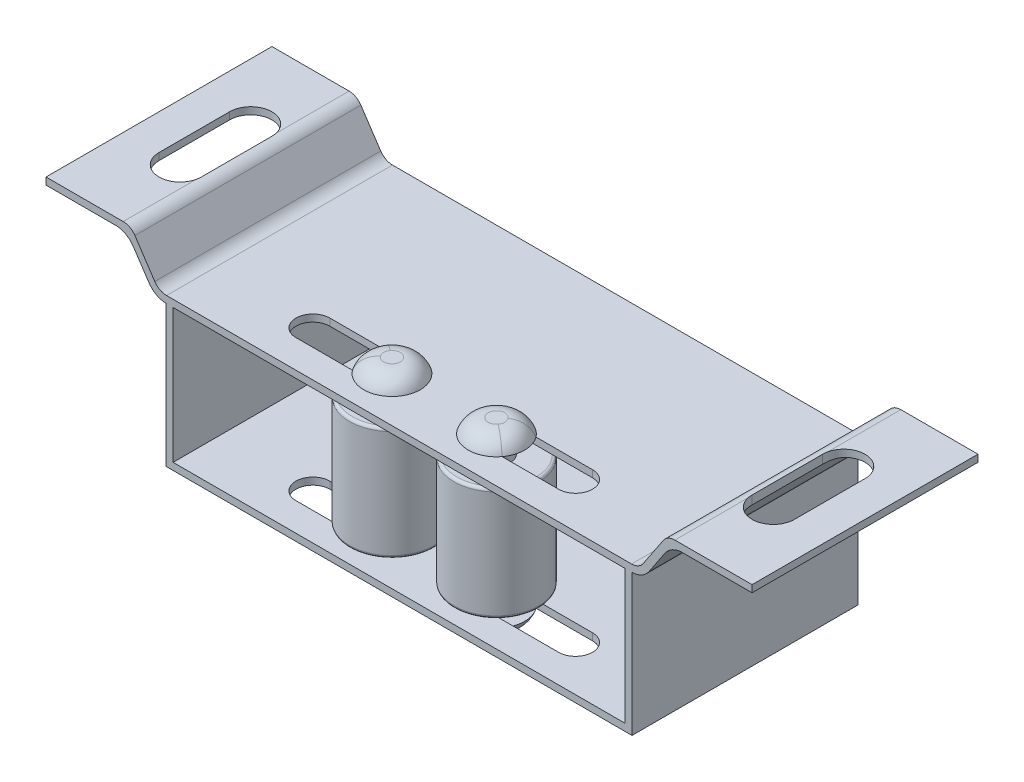
from build123d import *

# Parameters (mm, degrees)
EXTRUDE_1_DEPTH     = 8
SKETCH_2_W          = 33
SKETCH_2_H          = 16
EXTRUDE_1_2_DEPTH   = 10
SHELL_START         = -10
SHELL_1_OUTLINE_W   = 32
SHELL_1_OUTLINE_H   = 15.5
SHELL_1_DEPTH       = 9.5
FILLET_1_R          = 1.5
FILLET_2_R          = 1
CUT_EXTRUDE_1_DEPTH = 30.516944286
SKETCH_4_R          = 1
EXTRUDE_2_DEPTH     = 5.25
EXTRUDE_2_2_DEPTH   = 5.25
SKETCH_5_R          = 2
EXTRUDE_3_DEPTH     = 1
FILLET_3_R          = 1.5
SKETCH_6_R          = 2
EXTRUDE_4_DEPTH     = 1
FILLET_4_R          = 1.5
SKETCH_7_R          = 3
EXTRUDE_5_DEPTH     = 4
CUT_EXTRUDE_2_DEPTH = 4
FILLET_5_R          = 0.2


# Read off the part's stored shape, not the designer's step: 抽壳1
with BuildPart() as part:
    # 草图1 → Extrude 1 (new, symmetric)
    with BuildSketch(Plane.XY):
        Polygon((-25, 3), (-19, 3), (-17, 0), (17, 0), (19, 3), (25, 3), (25, 2.5), (19.267591879, 2.5), (17.267591879, -0.5), (-17.267591879, -0.5), (-19.267591879, 2.5), (-25, 2.5), align=None)
    extrude(amount=EXTRUDE_1_DEPTH, both=True)

    # 草图2 → Extrude 1 2 (add)
    with BuildSketch(Plane.XZ.offset(0.5)):
        Rectangle(SKETCH_2_W, SKETCH_2_H)
    extrude(amount=EXTRUDE_1_2_DEPTH)

    # 抽壳1 outline → 抽壳1 (cut)
    with BuildSketch(Plane(origin=(0, 0, 0), x_dir=(1, 0, 0), z_dir=(0, 1, 0)).offset(SHELL_START)):
        with Locations((0, -0.25)):
            Rectangle(SHELL_1_OUTLINE_W, SHELL_1_OUTLINE_H)
    extrude(amount=SHELL_1_DEPTH, mode=Mode.SUBTRACT)

    # 圆角1
    # the kernel refuses this fillet: 1.5 mm, written as the material it adds along each edge
    with BuildSketch(Plane(origin=(19.267591879, 2.5, 8), x_dir=(1, 0, 0), z_dir=(0, 0, -1)), Plane(origin=(-19.267591879, 2.5, -8), x_dir=(-1, 0, 0), z_dir=(0, 0, 1))) as fillet_1_piece_1:
        with BuildLine():
            CenterArc((FILLET_1_R * 0.535183758488, FILLET_1_R), FILLET_1_R, 213.690067526, 56.309932474)
            Line((-FILLET_1_R * 0.29686653585, FILLET_1_R * 0.445299803775), (0, 0))
            Line((0, 0), (FILLET_1_R * 0.535183758488, 0))
        make_face()
    extrude(amount=16)
    # the kernel refuses this fillet: 1.5 mm, written as the material it takes off along each edge
    with BuildSketch(Plane(origin=(17.267591879, -0.5, 10.006939094), x_dir=(0.5547001962252275, 0.8320502943378448, 0), z_dir=(0, 0, -1))) as fillet_1_2_piece_1_section:
        with BuildLine():
            CenterArc((FILLET_1_R * 0.535183758488, -FILLET_1_R), FILLET_1_R, 90, 56.309932474)
            Line((-FILLET_1_R * 0.29686653585, -FILLET_1_R * 0.445299803775), (0, 0))
            Line((0, 0), (FILLET_1_R * 0.535183758488, 0))
        make_face()
    fillet_1_2_piece_1 = extrude(amount=20.013878189, mode=Mode.PRIVATE)
    fillet_1_2_piece_1 = split(fillet_1_2_piece_1, bisect_by=Plane(origin=(16.5, -0.354791462, 0), z_dir=(1, 0, 0)), keep=Keep.TOP, mode=Mode.PRIVATE)
    add(fillet_1_2_piece_1, mode=Mode.SUBTRACT)
    with BuildSketch(Plane(origin=(-17.267591879, -0.5, 10.006939094), x_dir=(1, 0, 0), z_dir=(0, 0, -1))) as fillet_1_2_piece_2_section:
        with BuildLine():
            CenterArc((FILLET_1_R * 0.535183758488, -FILLET_1_R), FILLET_1_R, 90, 56.309932474)
            Line((-FILLET_1_R * 0.29686653585, -FILLET_1_R * 0.445299803775), (0, 0))
            Line((0, 0), (FILLET_1_R * 0.535183758488, 0))
        make_face()
    fillet_1_2_piece_2 = extrude(amount=20.013878189, mode=Mode.PRIVATE)
    fillet_1_2_piece_2 = split(fillet_1_2_piece_2, bisect_by=Plane(origin=(-16.5, -0.354791462, 0), z_dir=(-1, 0, 0)), keep=Keep.TOP, mode=Mode.PRIVATE)
    add(fillet_1_2_piece_2, mode=Mode.SUBTRACT)

    # 圆角2
    fillet_2_edges = [part.edges().sort_by_distance(p)[0] for p in [
        (-19, 3, 0),
        (-17, 0, 0),
        (17, 0, 0),
        (19, 3, 0),
    ]]
    fillet(fillet_2_edges, radius=FILLET_2_R)

    # 草图3 → 切除-拉伸1 (cut, through all)
    with BuildSketch(Plane.XZ.offset(10.5)):
        with BuildLine():
            Line((-9.3, 6), (-3.7, 6))
            ThreePointArc((-3.7, 6), (-2.5, 4.8), (-3.7, 3.6))
            Line((-3.7, 3.6), (-9.3, 3.6))
            ThreePointArc((-9.3, 3.6), (-10.5, 4.8), (-9.3, 6))
        make_face()
        with BuildLine():
            Line((3.7, 6), (9.3, 6))
            ThreePointArc((9.3, 6), (10.5, 4.8), (9.3, 3.6))
            Line((9.3, 3.6), (3.7, 3.6))
            ThreePointArc((3.7, 3.6), (2.5, 4.8), (3.7, 6))
        make_face()
    extrude(amount=-CUT_EXTRUDE_1_DEPTH, mode=Mode.SUBTRACT)



with BuildPart() as body_2:
    # 草图4 → 凸台-拉伸2 (new, symmetric)
    with BuildSketch(Plane.XZ.offset(5.25)):
        with Locations(Location((3.7, 4.8, 0), (0, 0, 90))):
            Circle(SKETCH_4_R)
    extrude(amount=EXTRUDE_2_DEPTH, both=True)


with BuildPart() as body_3:
    # 草图4 → Extrude 2 2 (new, symmetric)
    with BuildSketch(Plane.XZ.offset(5.25)):
        with Locations(Location((-3.7, 4.8, 0), (0, 0, 90))):
            Circle(SKETCH_4_R)
    extrude(amount=EXTRUDE_2_2_DEPTH, both=True)


with BuildPart() as part_1:
    add(part.part)

    add(body_2.part)  # 凸台-拉伸3 merges body 2

    add(body_3.part)  # 凸台-拉伸3 merges body 3
    # 草图5 → 凸台-拉伸3 (add)
    with BuildSketch(Plane.XZ.offset(10.5)):
        with Locations(Location((3.7, 4.8, 0), (0, 0, 36.869897646))):
            Circle(SKETCH_5_R)
        with Locations(Location((-3.7, 4.8, 0), (0, 0, 143.130102354))):
            Circle(SKETCH_5_R)
    extrude(amount=EXTRUDE_3_DEPTH)

    # 圆角3
    # the kernel refuses this fillet: 1.5 mm, written as the material it takes off along each edge
    with BuildSketch(Plane(origin=(3.7, -11.5, 4.8), x_dir=(0.7999999999983667, 0, 0.6000000000021778), z_dir=(0.6000000000021778, 0, -0.7999999999983667))) as fillet_3_piece_1:
        with BuildLine():
            CenterArc((0.585786438, -1.5), FILLET_3_R, 19.471220634, 70.528779366)
            Line((0.585786438, 0), (0.585786438, 0.03))
            Line((0.585786438, 0.03), (2, 0.03))
            Line((2, 0.03), (2.03, 0))
            ThreePointArc((2.03, 0), (2.03, -0.5), (2.028284271, -0.99))
            Line((2.028284271, -0.99), (2, -1))
        make_face()
    revolve(axis=Axis((3.7, -11.5, 4.8), (0, -1, 0)), mode=Mode.SUBTRACT)
    with BuildSketch(Plane(origin=(-3.7, -11.5, 4.8), x_dir=(-0.7999999999983667, 0, 0.6000000000021778), z_dir=(0.6000000000021778, 0, 0.7999999999983667))) as fillet_3_piece_2:
        with BuildLine():
            CenterArc((0.585786438, -1.5), FILLET_3_R, 19.471220634, 70.528779366)
            Line((0.585786438, 0), (0.585786438, 0.03))
            Line((0.585786438, 0.03), (2, 0.03))
            Line((2, 0.03), (2.03, 0))
            ThreePointArc((2.03, 0), (2.03, -0.5), (2.028284271, -0.99))
            Line((2.028284271, -0.99), (2, -1))
        make_face()
    revolve(axis=Axis((-3.7, -11.5, 4.8), (0, -1, 0)), mode=Mode.SUBTRACT)

    # 草图6 → 凸台-拉伸4 (add)
    with BuildSketch(Plane(origin=(0, 0, 0), x_dir=(1, 0, 0), z_dir=(0, 1, 0))):
        with Locations(Location((3.7, -4.8, 0), (0, 0, 36.869897646))):
            Circle(SKETCH_6_R)
        with Locations(Location((-3.7, -4.8, 0), (0, 0, 143.130102354))):
            Circle(SKETCH_6_R)
    extrude(amount=EXTRUDE_4_DEPTH)

    # 圆角4
    # the kernel refuses this fillet: 1.5 mm, written as the material it takes off along each edge
    with BuildSketch(Plane(origin=(3.7, 1, 4.8), x_dir=(0.7999999999983667, 0, -0.6000000000021778), z_dir=(0.6000000000021778, 0, 0.7999999999983667))) as fillet_4_piece_1:
        with BuildLine():
            CenterArc((0.585786438, -1.5), FILLET_4_R, 19.471220634, 70.528779366)
            Line((0.585786438, 0), (0.585786438, 0.03))
            Line((0.585786438, 0.03), (2, 0.03))
            Line((2, 0.03), (2.03, 0))
            ThreePointArc((2.03, 0), (2.03, -0.5), (2.028284271, -0.99))
            Line((2.028284271, -0.99), (2, -1))
        make_face()
    revolve(axis=Axis((3.7, 1, 4.8), (0, 1, 0)), mode=Mode.SUBTRACT)
    with BuildSketch(Plane(origin=(-3.7, 1, 4.8), x_dir=(-0.7999999999983667, 0, -0.6000000000021778), z_dir=(0.6000000000021778, 0, -0.7999999999983667))) as fillet_4_piece_2:
        with BuildLine():
            CenterArc((0.585786438, -1.5), FILLET_4_R, 19.471220634, 70.528779366)
            Line((0.585786438, 0), (0.585786438, 0.03))
            Line((0.585786438, 0.03), (2, 0.03))
            Line((2, 0.03), (2.03, 0))
            ThreePointArc((2.03, 0), (2.03, -0.5), (2.028284271, -0.99))
            Line((2.028284271, -0.99), (2, -1))
        make_face()
    revolve(axis=Axis((-3.7, 1, 4.8), (0, 1, 0)), mode=Mode.SUBTRACT)

    # 草图7 → 凸台-拉伸5 (add, symmetric)
    with BuildSketch(Plane.XZ.offset(5.25)):
        with Locations(Location((3.7, 4.8, 0), (0, 0, 270))):
            Circle(SKETCH_7_R)
        with Locations(Location((-3.7, 4.8, 0), (0, 0, 270))):
            Circle(SKETCH_7_R)
    extrude(amount=EXTRUDE_5_DEPTH, both=True)

    # 草图8 → 切除-拉伸2 (cut, symmetric)
    with BuildSketch(Plane.XZ.offset(-2.5)):
        with BuildLine():
            Line((-19.5, 2.5), (-19.5, -2.5))
            ThreePointArc((-19.5, -2.5), (-21, -4), (-22.5, -2.5))
            Line((-22.5, -2.5), (-22.5, 2.5))
            ThreePointArc((-22.5, 2.5), (-21, 4), (-19.5, 2.5))
        make_face()
        with BuildLine():
            Line((22.5, 2.5), (22.5, -2.5))
            ThreePointArc((22.5, -2.5), (21, -4), (19.5, -2.5))
            Line((19.5, -2.5), (19.5, 2.5))
            ThreePointArc((19.5, 2.5), (21, 4), (22.5, 2.5))
        make_face()
    extrude(amount=CUT_EXTRUDE_2_DEPTH, both=True, mode=Mode.SUBTRACT)

    # 圆角5
    fillet_5_edges = [part_1.edges().sort_by_distance(p)[0] for p in [
        (3.7, -9.25, 7.8),
        (3.7, -1.25, 7.8),
        (-3.7, -9.25, 7.8),
        (-3.7, -1.25, 7.8),
    ]]
    fillet(fillet_5_edges, radius=FILLET_5_R)


solid = part_1.part
